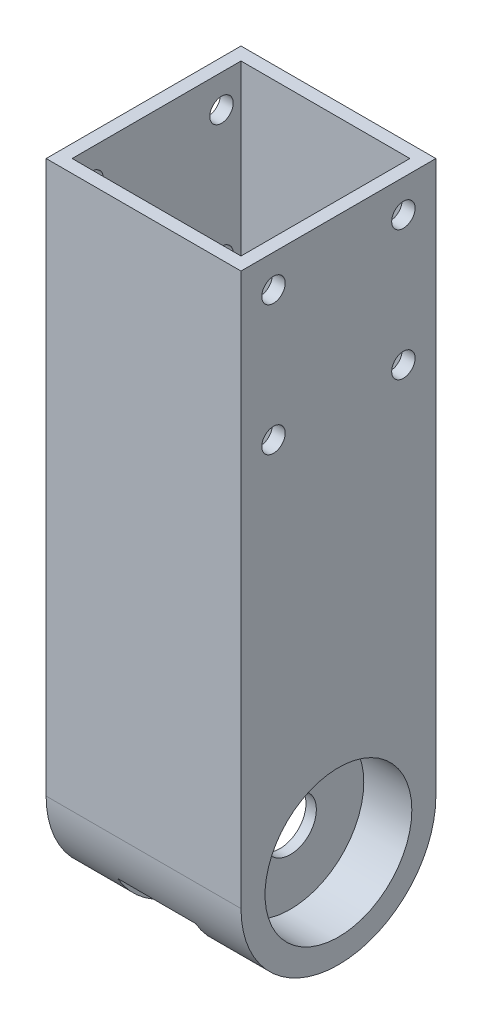
from build123d import *

# Parameters (mm, degrees)
SKETCH1_W            = 30
SKETCH1_H            = 30
SKETCH1_W_2          = 12
SKETCH1_H_2          = 26
BOSS_EXTRUDE2_DEPTH  = 100
SKETCH3_W            = 7
SKETCH3_H            = 26
CUT_EXTRUDE2_DEPTH   = 70
FILLET1_R            = 15
SKETCH5_R            = 4
CUT_EXTRUDE3_DEPTH   = 50
SKETCH6_R            = 11.3
CUT_EXTRUDE4_DEPTH   = 7.4
CUT_EXTRUDE5_START   = -7.4
SKETCH7_R            = 11.3
CUT_EXTRUDE5_DEPTH   = 7.4
M3_CLEARANCE_HOLE1_D = 3.6


with BuildPart() as part:
    # Sketch1 → Boss-Extrude2 (new body)
    with BuildSketch(Plane(origin=(0, 0, 0), x_dir=(1, 0, 0), z_dir=(0, 1, 0))):
        Rectangle(SKETCH1_W, SKETCH1_H)
        Rectangle(SKETCH1_W_2, SKETCH1_H_2, mode=Mode.SUBTRACT)
    extrude(amount=BOSS_EXTRUDE2_DEPTH)

    # Sketch3 → Cut-Extrude2 (cut)
    with BuildSketch(Plane(origin=(0, 100, 0), x_dir=(1, 0, 0), z_dir=(0, 1, 0))):
        with Locations((-9.5, 0)):
            Rectangle(SKETCH3_W, SKETCH3_H)
        with Locations((9.5, 0)):
            Rectangle(SKETCH3_W, SKETCH3_H)
    extrude(amount=-CUT_EXTRUDE2_DEPTH, mode=Mode.SUBTRACT)

    # Fillet1
    # the kernel refuses this fillet: 15 mm, written as the material it takes off along each edge
    with BuildSketch(Plane(origin=(52.5, 0, -15), x_dir=(0, 1, 0), z_dir=(-1, 0, 0)), Plane(origin=(-52.5, 0, 15), x_dir=(0, 1, 0), z_dir=(1, 0, 0))) as fillet1_piece_1:
        with BuildLine():
            CenterArc((FILLET1_R, -FILLET1_R), FILLET1_R, 90, 90)
            Line((0, -FILLET1_R), (0, 0))
            Line((0, 0), (FILLET1_R, 0))
        make_face()
    extrude(amount=105, mode=Mode.SUBTRACT)

    # Sketch5 → Cut-Extrude3 (cut)
    with BuildSketch(Plane(origin=(15, 0, 0), x_dir=(0, 0, -1), z_dir=(1, 0, 0))):
        with Locations((0, 15)):
            Circle(SKETCH5_R)
    extrude(amount=-CUT_EXTRUDE3_DEPTH, mode=Mode.SUBTRACT)

    # Sketch6 → Cut-Extrude4 (cut)
    with BuildSketch(Plane(origin=(15, 0, 0), x_dir=(0, 0, -1), z_dir=(1, 0, 0))):
        with Locations((0, 15)):
            Circle(SKETCH6_R)
    extrude(amount=-CUT_EXTRUDE4_DEPTH, mode=Mode.SUBTRACT)

    # Sketch7 → Cut-Extrude5 (cut)
    with BuildSketch(Plane.ZY.offset(15).offset(CUT_EXTRUDE5_START)):
        with Locations(Location((0, 15, 0), (0, 0, 180))):
            Circle(SKETCH7_R)
    extrude(amount=CUT_EXTRUDE5_DEPTH, mode=Mode.SUBTRACT)

    # M3 Clearance Hole1 (through all)
    with Locations(Plane(origin=(15, 0, 0), x_dir=(0, 0, -1), z_dir=(1, 0, 0))):
        with Locations((-10, 95), (-10, 75), (10, 75), (10, 95)):
            Hole(M3_CLEARANCE_HOLE1_D / 2)


solid = part.part
